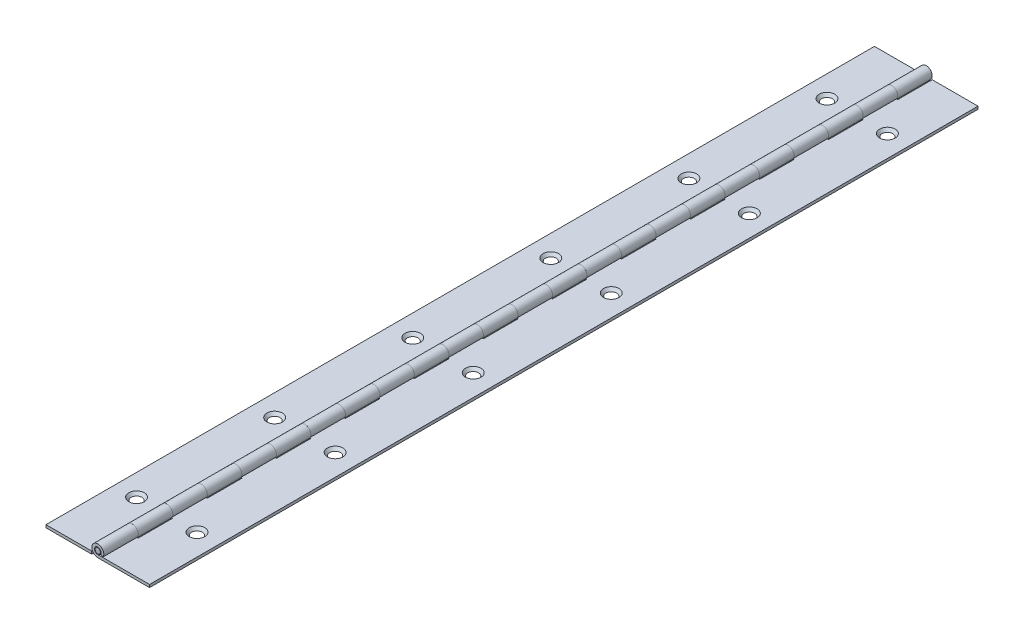
from build123d import *

# Parameters (mm, degrees)
EXTRUDE1_DEPTH     = 609.6
SKETCH3_W          = 4.41325
SKETCH3_H          = 12.7
CUT_EXTRUDE1_DEPTH = 25.4
LPATTERN1_COUNT    = 48
LPATTERN1_PITCH    = 25.4
EXTRUDE2_DEPTH     = 12.7
LPATTERN3_COUNT    = 48
LPATTERN3_PITCH    = 25.4
SKETCH6_W          = 16.817975
SKETCH6_H          = 1.016
EXTRUDE5_DEPTH     = 1219.2
LPATTERN4_COUNT    = 24
LPATTERN4_PITCH    = 50.8
LPATTERN5_COUNT    = 24
LPATTERN5_PITCH    = 50.8
SKETCH7_R          = 1.190625
EXTRUDE4_DEPTH     = 609.6
CHAMFER1_SIZE      = 0.238125
SKETCH12_W         = 348.018282236
SKETCH12_H         = 1335.410284064
EXTRUDE8_DEPTH     = 8.89


with BuildPart() as part:
    # Sketch2 → Extrude1 (new, symmetric)
    with BuildSketch(Plane.XY):
        with BuildLine():
            Line((19.05, -1.190625), (19.05, -2.206625))
            Line((19.05, -2.206625), (0, -2.206625))
            ThreePointArc((0, -2.206625), (-1.185618748, 1.861048649), (1.999881421, -0.932560022))
            Line((1.999881421, -0.932560022), (1.079072709, -0.503179868))
            ThreePointArc((1.079072709, -0.503179868), (-0.639722346, 1.00416294), (0, -1.190625))
            Line((0, -1.190625), (19.05, -1.190625))
        make_face()
    extrude(amount=EXTRUDE1_DEPTH, both=True)

    # Sketch3 → Cut-Extrude1 (cut, symmetric)
    with BuildSketch(Plane(origin=(0, -1.190625, 0), x_dir=(1, 0, 0), z_dir=(0, 1, 0))):
        with Locations((0, -590.55)):
            Rectangle(SKETCH3_W, SKETCH3_H)
    cut_extrude1 = extrude(amount=CUT_EXTRUDE1_DEPTH, both=True, mode=Mode.SUBTRACT)

    # LPattern1: Cut-Extrude1 ×48
    with Locations(*[(0, 0, -i * LPATTERN1_PITCH) for i in range(1, LPATTERN1_COUNT)]):
        add(cut_extrude1, mode=Mode.SUBTRACT)

    # Cut-Extrude2 cone 1 section (through the dimple's axis) → Cut-Extrude2 (revolve, cut)
    with BuildSketch(Plane(origin=(11.1252, -1.190625, -584.2), x_dir=(0, 0, 1), z_dir=(1, 0, 0))):
        Polygon((0, 0), (2.8575, 0), (0, 3.287177724), align=None)
    cut_extrude2 = revolve(axis=Axis((11.1252, -1.190625, -584.2), (0, -1, 0)), mode=Mode.SUBTRACT)

    # LPattern4: Cut-Extrude2 ×24
    with Locations(*[(0, 0, i * LPATTERN4_PITCH) for i in range(1, LPATTERN4_COUNT)]):
        add(cut_extrude2, mode=Mode.SUBTRACT)


with BuildPart() as body_2:
    # Sketch5 → Extrude2 (new body)
    with BuildSketch(Plane(origin=(0, 0, -609.6), x_dir=(-1, 0, 0), z_dir=(0, 0, -1))):
        with BuildLine():
            Line((0, -1.190625), (19.05, -1.190625))
            Line((19.05, -1.190625), (19.05, -2.206625))
            Line((19.05, -2.206625), (0, -2.206625))
            ThreePointArc((0, -2.206625), (-1.185618748, 1.861048649), (1.999881421, -0.932560022))
            Line((1.999881421, -0.932560022), (1.079072709, -0.503179868))
            ThreePointArc((1.079072709, -0.503179868), (-0.639722346, 1.00416294), (0, -1.190625))
        make_face()
    extrude(amount=-EXTRUDE2_DEPTH)


with BuildPart() as lpattern3_1:
    # LPattern3: pattern copy
    add(body_2.part.moved(Location(Vector(0, 0, 1) * (1 * LPATTERN3_PITCH))))


with BuildPart() as lpattern3_2:
    # LPattern3: pattern copy
    add(body_2.part.moved(Location(Vector(0, 0, 1) * (2 * LPATTERN3_PITCH))))


with BuildPart() as lpattern3_3:
    # LPattern3: pattern copy
    add(body_2.part.moved(Location(Vector(0, 0, 1) * (3 * LPATTERN3_PITCH))))


with BuildPart() as lpattern3_4:
    # LPattern3: pattern copy
    add(body_2.part.moved(Location(Vector(0, 0, 1) * (4 * LPATTERN3_PITCH))))


with BuildPart() as lpattern3_5:
    # LPattern3: pattern copy
    add(body_2.part.moved(Location(Vector(0, 0, 1) * (5 * LPATTERN3_PITCH))))


with BuildPart() as lpattern3_6:
    # LPattern3: pattern copy
    add(body_2.part.moved(Location(Vector(0, 0, 1) * (6 * LPATTERN3_PITCH))))


with BuildPart() as lpattern3_7:
    # LPattern3: pattern copy
    add(body_2.part.moved(Location(Vector(0, 0, 1) * (7 * LPATTERN3_PITCH))))


with BuildPart() as lpattern3_8:
    # LPattern3: pattern copy
    add(body_2.part.moved(Location(Vector(0, 0, 1) * (8 * LPATTERN3_PITCH))))


with BuildPart() as lpattern3_9:
    # LPattern3: pattern copy
    add(body_2.part.moved(Location(Vector(0, 0, 1) * (9 * LPATTERN3_PITCH))))


with BuildPart() as lpattern3_10:
    # LPattern3: pattern copy
    add(body_2.part.moved(Location(Vector(0, 0, 1) * (10 * LPATTERN3_PITCH))))


with BuildPart() as lpattern3_11:
    # LPattern3: pattern copy
    add(body_2.part.moved(Location(Vector(0, 0, 1) * (11 * LPATTERN3_PITCH))))


with BuildPart() as lpattern3_12:
    # LPattern3: pattern copy
    add(body_2.part.moved(Location(Vector(0, 0, 1) * (12 * LPATTERN3_PITCH))))


with BuildPart() as lpattern3_13:
    # LPattern3: pattern copy
    add(body_2.part.moved(Location(Vector(0, 0, 1) * (13 * LPATTERN3_PITCH))))


with BuildPart() as lpattern3_14:
    # LPattern3: pattern copy
    add(body_2.part.moved(Location(Vector(0, 0, 1) * (14 * LPATTERN3_PITCH))))


with BuildPart() as lpattern3_15:
    # LPattern3: pattern copy
    add(body_2.part.moved(Location(Vector(0, 0, 1) * (15 * LPATTERN3_PITCH))))


with BuildPart() as lpattern3_16:
    # LPattern3: pattern copy
    add(body_2.part.moved(Location(Vector(0, 0, 1) * (16 * LPATTERN3_PITCH))))


with BuildPart() as lpattern3_17:
    # LPattern3: pattern copy
    add(body_2.part.moved(Location(Vector(0, 0, 1) * (17 * LPATTERN3_PITCH))))


with BuildPart() as lpattern3_18:
    # LPattern3: pattern copy
    add(body_2.part.moved(Location(Vector(0, 0, 1) * (18 * LPATTERN3_PITCH))))


with BuildPart() as lpattern3_19:
    # LPattern3: pattern copy
    add(body_2.part.moved(Location(Vector(0, 0, 1) * (19 * LPATTERN3_PITCH))))


with BuildPart() as lpattern3_20:
    # LPattern3: pattern copy
    add(body_2.part.moved(Location(Vector(0, 0, 1) * (20 * LPATTERN3_PITCH))))


with BuildPart() as lpattern3_21:
    # LPattern3: pattern copy
    add(body_2.part.moved(Location(Vector(0, 0, 1) * (21 * LPATTERN3_PITCH))))


with BuildPart() as lpattern3_22:
    # LPattern3: pattern copy
    add(body_2.part.moved(Location(Vector(0, 0, 1) * (22 * LPATTERN3_PITCH))))


with BuildPart() as lpattern3_23:
    # LPattern3: pattern copy
    add(body_2.part.moved(Location(Vector(0, 0, 1) * (23 * LPATTERN3_PITCH))))


with BuildPart() as lpattern3_24:
    # LPattern3: pattern copy
    add(body_2.part.moved(Location(Vector(0, 0, 1) * (24 * LPATTERN3_PITCH))))


with BuildPart() as lpattern3_25:
    # LPattern3: pattern copy
    add(body_2.part.moved(Location(Vector(0, 0, 1) * (25 * LPATTERN3_PITCH))))


with BuildPart() as lpattern3_26:
    # LPattern3: pattern copy
    add(body_2.part.moved(Location(Vector(0, 0, 1) * (26 * LPATTERN3_PITCH))))


with BuildPart() as lpattern3_27:
    # LPattern3: pattern copy
    add(body_2.part.moved(Location(Vector(0, 0, 1) * (27 * LPATTERN3_PITCH))))


with BuildPart() as lpattern3_28:
    # LPattern3: pattern copy
    add(body_2.part.moved(Location(Vector(0, 0, 1) * (28 * LPATTERN3_PITCH))))


with BuildPart() as lpattern3_29:
    # LPattern3: pattern copy
    add(body_2.part.moved(Location(Vector(0, 0, 1) * (29 * LPATTERN3_PITCH))))


with BuildPart() as lpattern3_30:
    # LPattern3: pattern copy
    add(body_2.part.moved(Location(Vector(0, 0, 1) * (30 * LPATTERN3_PITCH))))


with BuildPart() as lpattern3_31:
    # LPattern3: pattern copy
    add(body_2.part.moved(Location(Vector(0, 0, 1) * (31 * LPATTERN3_PITCH))))


with BuildPart() as lpattern3_32:
    # LPattern3: pattern copy
    add(body_2.part.moved(Location(Vector(0, 0, 1) * (32 * LPATTERN3_PITCH))))


with BuildPart() as lpattern3_33:
    # LPattern3: pattern copy
    add(body_2.part.moved(Location(Vector(0, 0, 1) * (33 * LPATTERN3_PITCH))))


with BuildPart() as lpattern3_34:
    # LPattern3: pattern copy
    add(body_2.part.moved(Location(Vector(0, 0, 1) * (34 * LPATTERN3_PITCH))))


with BuildPart() as lpattern3_35:
    # LPattern3: pattern copy
    add(body_2.part.moved(Location(Vector(0, 0, 1) * (35 * LPATTERN3_PITCH))))


with BuildPart() as lpattern3_36:
    # LPattern3: pattern copy
    add(body_2.part.moved(Location(Vector(0, 0, 1) * (36 * LPATTERN3_PITCH))))


with BuildPart() as lpattern3_37:
    # LPattern3: pattern copy
    add(body_2.part.moved(Location(Vector(0, 0, 1) * (37 * LPATTERN3_PITCH))))


with BuildPart() as lpattern3_38:
    # LPattern3: pattern copy
    add(body_2.part.moved(Location(Vector(0, 0, 1) * (38 * LPATTERN3_PITCH))))


with BuildPart() as lpattern3_39:
    # LPattern3: pattern copy
    add(body_2.part.moved(Location(Vector(0, 0, 1) * (39 * LPATTERN3_PITCH))))


with BuildPart() as lpattern3_40:
    # LPattern3: pattern copy
    add(body_2.part.moved(Location(Vector(0, 0, 1) * (40 * LPATTERN3_PITCH))))


with BuildPart() as lpattern3_41:
    # LPattern3: pattern copy
    add(body_2.part.moved(Location(Vector(0, 0, 1) * (41 * LPATTERN3_PITCH))))


with BuildPart() as lpattern3_42:
    # LPattern3: pattern copy
    add(body_2.part.moved(Location(Vector(0, 0, 1) * (42 * LPATTERN3_PITCH))))


with BuildPart() as lpattern3_43:
    # LPattern3: pattern copy
    add(body_2.part.moved(Location(Vector(0, 0, 1) * (43 * LPATTERN3_PITCH))))


with BuildPart() as lpattern3_44:
    # LPattern3: pattern copy
    add(body_2.part.moved(Location(Vector(0, 0, 1) * (44 * LPATTERN3_PITCH))))


with BuildPart() as lpattern3_45:
    # LPattern3: pattern copy
    add(body_2.part.moved(Location(Vector(0, 0, 1) * (45 * LPATTERN3_PITCH))))


with BuildPart() as lpattern3_46:
    # LPattern3: pattern copy
    add(body_2.part.moved(Location(Vector(0, 0, 1) * (46 * LPATTERN3_PITCH))))


with BuildPart() as lpattern3_47:
    # LPattern3: pattern copy
    add(body_2.part.moved(Location(Vector(0, 0, 1) * (47 * LPATTERN3_PITCH))))


with BuildPart() as body_2_1:
    add(body_2.part)

    add(lpattern3_1.part)  # Extrude5 merges LPattern3_1

    add(lpattern3_2.part)  # Extrude5 merges LPattern3_2

    add(lpattern3_3.part)  # Extrude5 merges LPattern3_3

    add(lpattern3_4.part)  # Extrude5 merges LPattern3_4

    add(lpattern3_5.part)  # Extrude5 merges LPattern3_5

    add(lpattern3_6.part)  # Extrude5 merges LPattern3_6

    add(lpattern3_7.part)  # Extrude5 merges LPattern3_7

    add(lpattern3_8.part)  # Extrude5 merges LPattern3_8

    add(lpattern3_9.part)  # Extrude5 merges LPattern3_9

    add(lpattern3_10.part)  # Extrude5 merges LPattern3_10

    add(lpattern3_11.part)  # Extrude5 merges LPattern3_11

    add(lpattern3_12.part)  # Extrude5 merges LPattern3_12

    add(lpattern3_13.part)  # Extrude5 merges LPattern3_13

    add(lpattern3_14.part)  # Extrude5 merges LPattern3_14

    add(lpattern3_15.part)  # Extrude5 merges LPattern3_15

    add(lpattern3_16.part)  # Extrude5 merges LPattern3_16

    add(lpattern3_17.part)  # Extrude5 merges LPattern3_17

    add(lpattern3_18.part)  # Extrude5 merges LPattern3_18

    add(lpattern3_19.part)  # Extrude5 merges LPattern3_19

    add(lpattern3_20.part)  # Extrude5 merges LPattern3_20

    add(lpattern3_21.part)  # Extrude5 merges LPattern3_21

    add(lpattern3_22.part)  # Extrude5 merges LPattern3_22

    add(lpattern3_23.part)  # Extrude5 merges LPattern3_23

    add(lpattern3_24.part)  # Extrude5 merges LPattern3_24

    add(lpattern3_25.part)  # Extrude5 merges LPattern3_25

    add(lpattern3_26.part)  # Extrude5 merges LPattern3_26

    add(lpattern3_27.part)  # Extrude5 merges LPattern3_27

    add(lpattern3_28.part)  # Extrude5 merges LPattern3_28

    add(lpattern3_29.part)  # Extrude5 merges LPattern3_29

    add(lpattern3_30.part)  # Extrude5 merges LPattern3_30

    add(lpattern3_31.part)  # Extrude5 merges LPattern3_31

    add(lpattern3_32.part)  # Extrude5 merges LPattern3_32

    add(lpattern3_33.part)  # Extrude5 merges LPattern3_33

    add(lpattern3_34.part)  # Extrude5 merges LPattern3_34

    add(lpattern3_35.part)  # Extrude5 merges LPattern3_35

    add(lpattern3_36.part)  # Extrude5 merges LPattern3_36

    add(lpattern3_37.part)  # Extrude5 merges LPattern3_37

    add(lpattern3_38.part)  # Extrude5 merges LPattern3_38

    add(lpattern3_39.part)  # Extrude5 merges LPattern3_39

    add(lpattern3_40.part)  # Extrude5 merges LPattern3_40

    add(lpattern3_41.part)  # Extrude5 merges LPattern3_41

    add(lpattern3_42.part)  # Extrude5 merges LPattern3_42

    add(lpattern3_43.part)  # Extrude5 merges LPattern3_43

    add(lpattern3_44.part)  # Extrude5 merges LPattern3_44

    add(lpattern3_45.part)  # Extrude5 merges LPattern3_45

    add(lpattern3_46.part)  # Extrude5 merges LPattern3_46

    add(lpattern3_47.part)  # Extrude5 merges LPattern3_47
    # Sketch6 → Extrude5 (add)
    with BuildSketch(Plane(origin=(0, 0, -609.6), x_dir=(-1, 0, 0), z_dir=(0, 0, -1))):
        with Locations((10.6410125, -1.698625)):
            Rectangle(SKETCH6_W, SKETCH6_H)
    extrude(amount=-EXTRUDE5_DEPTH)

    # Cut-Extrude3 cone 1 section (through the dimple's axis) → Cut-Extrude3 (revolve, cut)
    with BuildSketch(Plane(origin=(-11.1252, -1.190625, -584.2), x_dir=(0, 0, 1), z_dir=(1, 0, 0))):
        Polygon((0, 0), (2.8575, 0), (0, 3.287177724), align=None)
    cut_extrude3 = revolve(axis=Axis((-11.1252, -1.190625, -584.2), (0, -1, 0)), mode=Mode.SUBTRACT)

    # LPattern5: Cut-Extrude3 ×24
    with Locations(*[(0, 0, i * LPATTERN5_PITCH) for i in range(1, LPATTERN5_COUNT)]):
        add(cut_extrude3, mode=Mode.SUBTRACT)


with BuildPart() as body_3:
    # Sketch7 → Extrude4 (new, symmetric)
    with BuildSketch(Plane.XY):
        with Locations(Location((0, 0, 0), (0, 0, 180))):
            Circle(SKETCH7_R)
    extrude(amount=EXTRUDE4_DEPTH, both=True)

    # Chamfer1
    chamfer1_edges = [body_3.edges().sort_by_distance(p)[0] for p in [
        (1.190625, 0, -609.6),
        (1.190625, 0, 609.6),
    ]]
    chamfer(chamfer1_edges, length=CHAMFER1_SIZE)


with BuildPart() as extrude8_tool:
    # Sketch12 → Extrude8 (new, symmetric)
    with BuildSketch(Plane(origin=(0, -1.190625, 0), x_dir=(1, 0, 0), z_dir=(0, 1, 0))):
        with Locations((91.66266083, 362.905142032)):
            Rectangle(SKETCH12_W, SKETCH12_H)
    extrude(amount=EXTRUDE8_DEPTH, both=True)


with BuildPart() as part_1:
    add(part.part)

    # Extrude8: cut by extrude8_tool
    add(extrude8_tool.part, mode=Mode.SUBTRACT)


with BuildPart() as body_2_2:
    add(body_2_1.part)

    # Extrude8: cut by extrude8_tool
    add(extrude8_tool.part, mode=Mode.SUBTRACT)


with BuildPart() as body_3_1:
    add(body_3.part)

    # Extrude8: cut by extrude8_tool
    add(extrude8_tool.part, mode=Mode.SUBTRACT)


solid = Compound([part_1.part, body_2_2.part, body_3_1.part])
